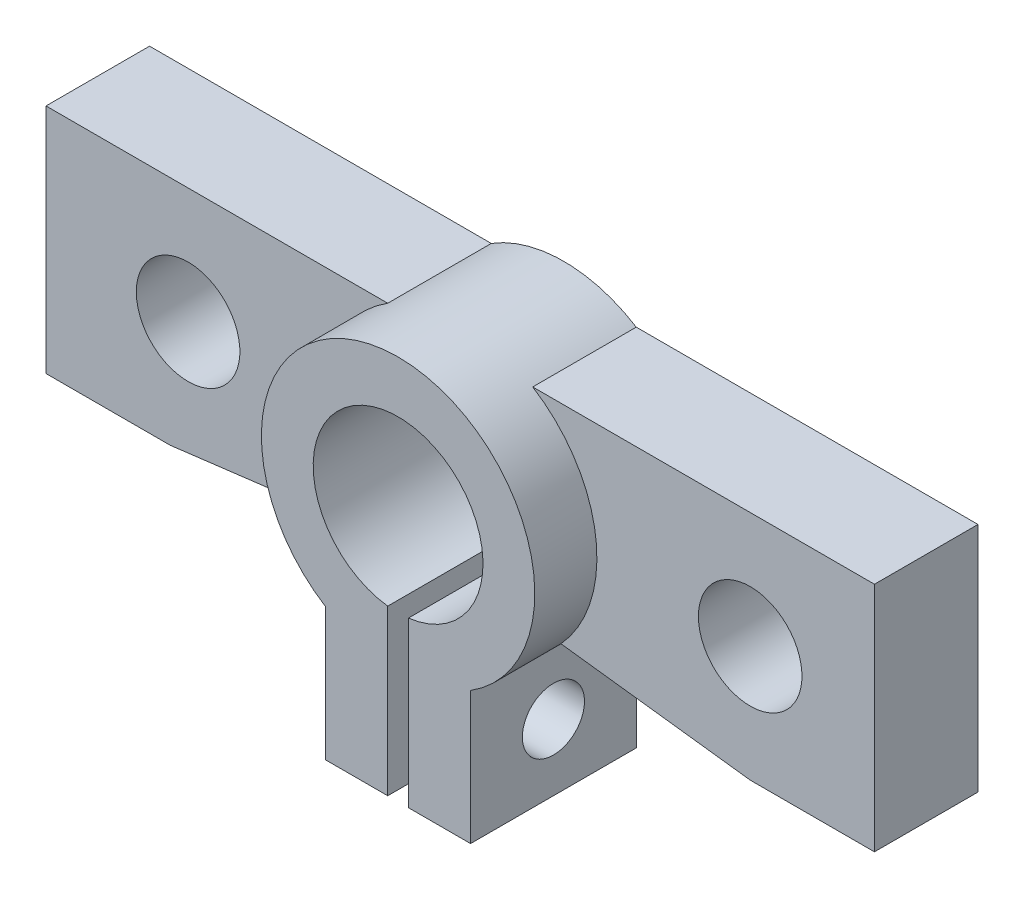
from build123d import *

# Parameters (mm, degrees)
BOSS_EXTRUDE1_DEPTH = 8
SKETCH2_R           = 1.5
CUT_EXTRUDE1_DEPTH  = 8
SKETCH4_R           = 2.5
BOSS_EXTRUDE2_DEPTH = 5


with BuildPart() as part:
    # Sketch1 → Boss-Extrude1 (new body)
    with BuildSketch(Plane(origin=(0, 0, 0), x_dir=(0, 1, 0), z_dir=(0, 0, 1))):
        with BuildLine():
            Line((-12, 3.5), (-5.595533933, 3.5))
            ThreePointArc((-5.595533933, 3.5), (6.6, 0), (-5.595533933, -3.5))
            Line((-5.595533933, -3.5), (-12, -3.5))
            Line((-12, -3.5), (-12, -0.5))
            Line((-12, -0.5), (-4.06939799, -0.5))
            ThreePointArc((-4.06939799, -0.5), (4.1, 0), (-4.06939799, 0.5))
            Line((-4.06939799, 0.5), (-12, 0.5))
            Line((-12, 0.5), (-12, 3.5))
        make_face()
    extrude(amount=BOSS_EXTRUDE1_DEPTH)

    # Sketch2 → Cut-Extrude1 (cut)
    with BuildSketch(Plane(origin=(-3.5, 0, 0), x_dir=(0, -1, 0), z_dir=(-1, 0, 0))):
        with Locations((8.797766967, 4)):
            Circle(SKETCH2_R)
    extrude(amount=-CUT_EXTRUDE1_DEPTH, mode=Mode.SUBTRACT)

    # Sketch4 → Boss-Extrude2 (add)
    # profile 1 of 2: a face of its own
    with BuildSketch(Plane(origin=(0, 0, 0), x_dir=(1, 0, 0), z_dir=(0, 0, -1))):
        with BuildLine():
            Line((-20, -5.595533933), (-3.5, -5.595533933))
            ThreePointArc((-3.5, -5.595533933), (-6.540217456, -0.886315759), (-4.863001587, 4.462198513))
            Line((-4.863001587, 4.462198513), (-14, 5.595533933))
            Line((-14, 5.595533933), (-20, 5.595533933))
            Line((-20, 5.595533933), (-20, -5.595533933))
        make_face()
        with Locations((-13.139356118, 0)):
            Circle(SKETCH4_R, mode=Mode.SUBTRACT)
    # profile 2 of 2: a face of its own
    with BuildSketch(Plane(origin=(0, 0, 0), x_dir=(1, 0, 0), z_dir=(0, 0, -1))):
        with BuildLine():
            Line((20, 5.595533933), (14, 5.595533933))
            Line((14, 5.595533933), (4.863001587, 4.462198513))
            ThreePointArc((4.863001587, 4.462198513), (6.540217456, -0.886315759), (3.5, -5.595533933))
            Line((3.5, -5.595533933), (20, -5.595533933))
            Line((20, -5.595533933), (20, 5.595533933))
        make_face()
        with Locations((14, 0)):
            Circle(SKETCH4_R, mode=Mode.SUBTRACT)
    extrude(amount=-BOSS_EXTRUDE2_DEPTH)


solid = part.part
